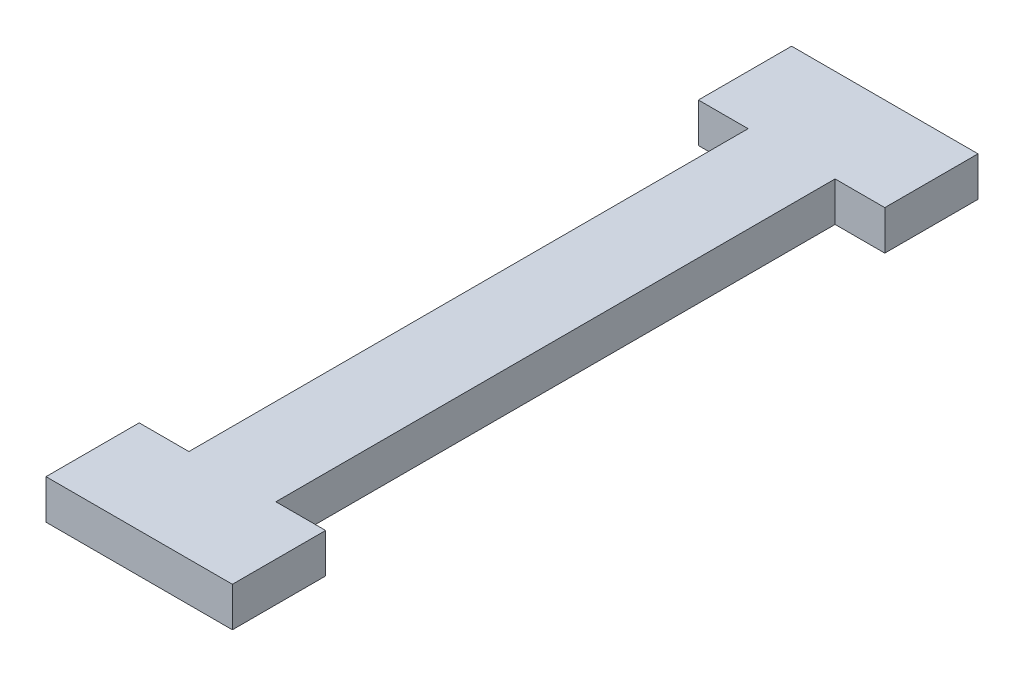
from build123d import *

# Parameters (mm, degrees)
BOSS_EXTRUDE1_DEPTH = 6.35


with BuildPart() as part:
    # Sketch1 → Boss-Extrude1 (new body)
    with BuildSketch(Plane(origin=(0, 0, 0), x_dir=(1, 0, 0), z_dir=(0, 1, 0))):
        Polygon((-15, 60), (15, 60), (15, 45), (7, 45), (7, -45), (15, -45), (15, -60), (-15, -60), (-15, -45), (-7, -45), (-7, 45), (-15, 45), align=None)
    extrude(amount=BOSS_EXTRUDE1_DEPTH)


solid = part.part
